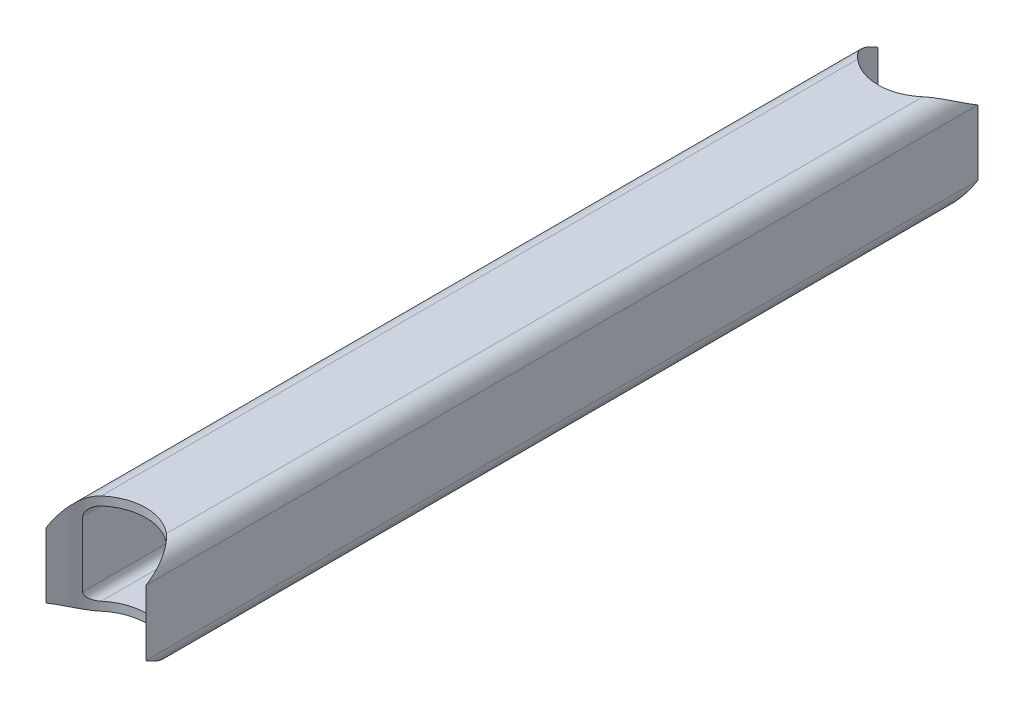
from build123d import *
from OCP.BRepAlgoAPI import BRepAlgoAPI_Cut
from OCP.TopTools import TopTools_ListOfShape

# Parameters (mm, degrees)
SISTEMA_START              = -170.205087805
SISTEMA_ESTRUCTURAL2_DEPTH = 250
CORTAR_EXTRUIR2_DEPTH      = 32


with BuildPart() as part:
    # Sistema estructural2: read off the stored shape, not the designer's step
    # Sistema estructural2 outline → Sistema estructural2 (new body)
    with BuildSketch(Plane.XY.offset(SISTEMA_START)):
        with BuildLine():
            ThreePointArc((15, 9.8), (13.476955262, 13.476955262), (9.8, 15))
            Line((9.8, 15), (-9.8, 15))
            ThreePointArc((-9.8, 15), (-13.476955262, 13.476955262), (-15, 9.8))
            Line((-15, 9.8), (-15, -9.8))
            ThreePointArc((-15, -9.8), (-13.476955262, -13.476955262), (-9.8, -15))
            Line((-9.8, -15), (9.8, -15))
            ThreePointArc((9.8, -15), (13.476955262, -13.476955262), (15, -9.8))
            Line((15, -9.8), (15, 9.8))
        make_face()
        with BuildLine():
            ThreePointArc((12.4, -9.8), (11.638477631, -11.638477631), (9.8, -12.4))
            Line((9.8, -12.4), (-9.8, -12.4))
            ThreePointArc((-9.8, -12.4), (-11.638477631, -11.638477631), (-12.4, -9.8))
            Line((-12.4, -9.8), (-12.4, 9.8))
            ThreePointArc((-12.4, 9.8), (-11.638477631, 11.638477631), (-9.8, 12.4))
            Line((-9.8, 12.4), (9.8, 12.4))
            ThreePointArc((9.8, 12.4), (11.638477631, 11.638477631), (12.4, 9.8))
            Line((12.4, 9.8), (12.4, -9.8))
        make_face(mode=Mode.SUBTRACT)
    extrude(amount=SISTEMA_ESTRUCTURAL2_DEPTH)


with BuildPart() as cortar_extruir2_tool:
    # Croquis10 → Cortar-Extruir2 (new body)
    with BuildSketch(Plane(origin=(0, 15, 0), x_dir=(1, 0, 0), z_dir=(0, 1, 0))):
        with BuildLine():
            Line((-15, -79.794912195), (15, -79.794912195))
            ThreePointArc((15, -79.794912195), (0, -64.794912195), (-15, -79.794912195))
        make_face()
        with BuildLine():
            Line((-15, 170.205087805), (15, 170.205087805))
            ThreePointArc((15, 170.205087805), (0, 155.205087805), (-15, 170.205087805))
        make_face()
    extrude(amount=-CORTAR_EXTRUIR2_DEPTH)


with BuildPart() as part_1:
    add(part.part)

    # Cortar-Extruir2: cut by cortar_extruir2_tool, with a tolerance
    cortar_extruir2_stock = TopTools_ListOfShape()
    cortar_extruir2_stock.Append(part_1.part.wrapped)
    cortar_extruir2_tools = TopTools_ListOfShape()
    cortar_extruir2_tools.Append(cortar_extruir2_tool.part.wrapped)
    cortar_extruir2_cut = BRepAlgoAPI_Cut()
    cortar_extruir2_cut.SetArguments(cortar_extruir2_stock)
    cortar_extruir2_cut.SetTools(cortar_extruir2_tools)
    cortar_extruir2_cut.SetFuzzyValue(0.00001)
    cortar_extruir2_cut.Build()
    add(Compound.cast(cortar_extruir2_cut.Shape()).solids(), mode=Mode.REPLACE)


solid = part_1.part
